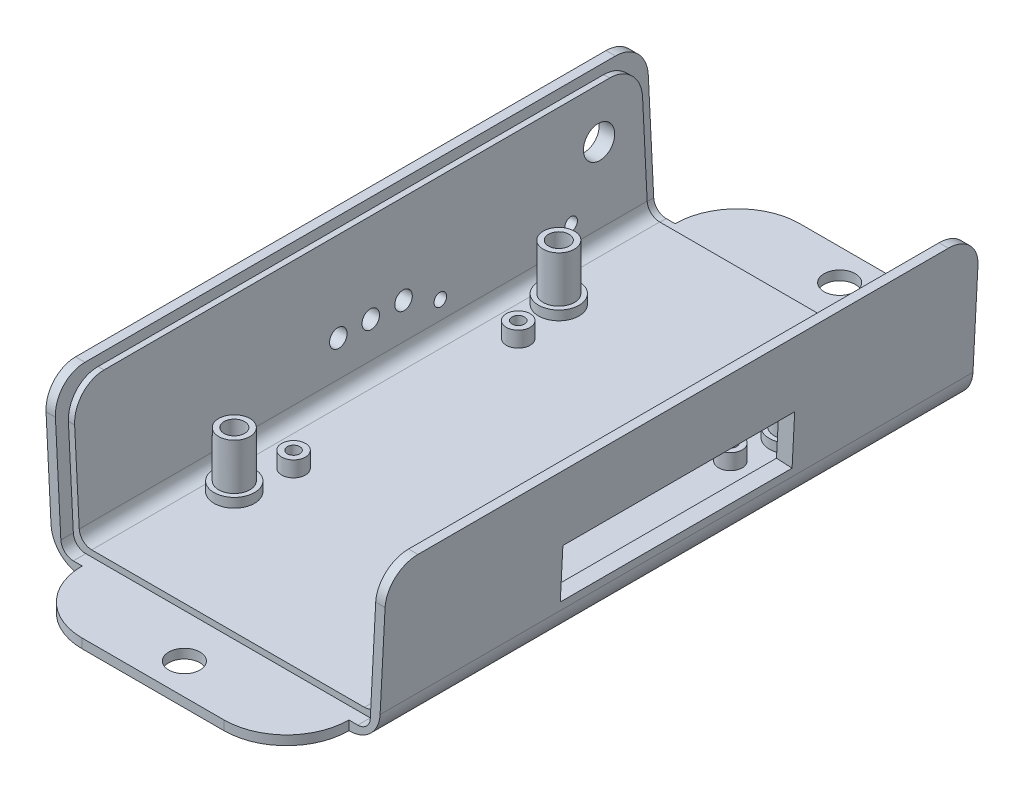
from build123d import *

# Parameters (mm, degrees)
BOSS_EXTRUDE1_DEPTH = 95
CUT_EXTRUDE1_DEPTH  = 1
CUT_EXTRUDE2_DEPTH  = 1
CUT_EXTRUDE4_DEPTH  = 2
CUT_EXTRUDE5_DEPTH  = 2
FILLET1_R           = 2
FILLET2_R           = 5
FILLET3_R           = 5
SKETCH11_R          = 3.25
SKETCH11_R_2        = 1.9
BOSS_EXTRUDE2_DEPTH = 1.5
SKETCH13_R          = 2.5
BOSS_EXTRUDE3_DEPTH = 7.4
SKETCH14_R          = 1.9
BOSS_EXTRUDE4_DEPTH = 1
SKETCH15_R          = 1.65
CUT_EXTRUDE7_DEPTH  = 15
SKETCH16_R          = 2.75
CUT_EXTRUDE8_DEPTH  = 1
SKETCH17_R          = 1
CUT_EXTRUDE9_DEPTH  = 2
SKETCH18_W          = 37.144162516
SKETCH18_H          = 8.058946384
CUT_EXTRUDE10_DEPTH = 3
SKETCH19_R          = 1
SKETCH19_R_2        = 1.4
CUT_EXTRUDE11_DEPTH = 3
SKETCH20_W          = 42.739965368
SKETCH20_H          = 1.5
BOSS_EXTRUDE5_DEPTH = 10
FILLET4_R           = 10
SKETCH21_W          = 42.739965368
SKETCH21_H          = 1.5
BOSS_EXTRUDE6_DEPTH = 10
FILLET5_R           = 10
SKETCH22_R          = 2.5
CUT_EXTRUDE12_DEPTH = 10
SKETCH23_R          = 2.5
CUT_EXTRUDE13_DEPTH = 4.5


with BuildPart() as part:
    # Sketch1 → Boss-Extrude1 (new body)
    with BuildSketch(Plane.XY):
        Polygon((-26.114805518, 0), (-27.425, 25), (-24.921569135, 25), (-23.742394101, 2.5), (23.742394101, 2.5), (24.921569135, 25), (27.425, 25), (26.114805518, 0), align=None)
    extrude(amount=BOSS_EXTRUDE1_DEPTH)

    # Sketch2 → Cut-Extrude1 (cut)
    with BuildSketch(Plane(origin=(23.546701863, -1.234030354, 0), x_dir=(0, 0, 1), z_dir=(-0.9986295347545742, 0.052335956242940705, 0))):
        Polygon((93, 3.739154736), (93, 24.853460661), (2, 24.853460661), (2, 3.739154736), (0, 3.739154736), (0, 26.853460661), (95, 26.853460661), (95, 3.739154736), align=None)
    extrude(amount=-CUT_EXTRUDE1_DEPTH, mode=Mode.SUBTRACT)

    # Sketch4 → Cut-Extrude2 (cut)
    with BuildSketch(Plane(origin=(-23.546701863, -1.234030354, 0), x_dir=(0, 0, -1), z_dir=(0.9986295347545742, 0.052335956242940414, 0))):
        Polygon((-95, 3.739154736), (-93, 3.739154736), (-93, 24.754638821), (-2, 24.754638821), (-2, 3.739154736), (0, 3.739154736), (0, 26.754638821), (-95, 26.754638821), align=None)
    extrude(amount=-CUT_EXTRUDE2_DEPTH, mode=Mode.SUBTRACT)

    # Sketch9 → Cut-Extrude4 (cut)
    with BuildSketch(Plane.XY.offset(95)):
        Polygon((-24.741023636, 2.447664044), (-24.691358668, 1.5), (24.691358668, 1.5), (24.743766447, 2.5), (23.742394101, 2.5), (-23.742394101, 2.5), (-24.743766447, 2.5), align=None)
    extrude(amount=-CUT_EXTRUDE4_DEPTH, mode=Mode.SUBTRACT)

    # Sketch10 → Cut-Extrude5 (cut)
    with BuildSketch(Plane(origin=(0, 0, 0), x_dir=(-1, 0, 0), z_dir=(0, 0, -1))):
        Polygon((-24.741023636, 2.447664044), (-24.691358668, 1.5), (24.691358668, 1.5), (24.741023636, 2.447664044), (24.743766447, 2.5), (23.742394101, 2.5), (-23.742394101, 2.5), (-24.743766447, 2.5), align=None)
    extrude(amount=-CUT_EXTRUDE5_DEPTH, mode=Mode.SUBTRACT)

    # Fillet1
    fillet1_edges = [part.edges().sort_by_distance(p)[0] for p in [
        (24.691358668, 1.5, 1),
        (-24.691358668, 1.5, 1),
        (23.742394101, 2.5, 47.5),
        (-23.742394101, 2.5, 47.5),
        (-24.691358668, 1.5, 94),
        (24.691358668, 1.5, 94),
    ]]
    fillet(fillet1_edges, radius=FILLET1_R)

    # Fillet2
    fillet2_edges = [part.edges().sort_by_distance(p)[0] for p in [
        (26.673970741, 25, 95),
        (25.34674626, 23.559201525, 93),
        (25.34674626, 23.559201525, 2),
        (-26.673970741, 25, 0),
        (-26.673970741, 25, 95),
        (-25.341574324, 23.460515117, 2),
        (-25.341574324, 23.460515117, 93),
        (26.673970741, 25, 0),
    ]]
    fillet(fillet2_edges, radius=FILLET2_R)

    # Fillet3
    fillet3_edges = [part.edges().sort_by_distance(p)[0] for p in [
        (-26.114805518, 0, 47.5),
        (26.114805518, 0, 47.5),
    ]]
    fillet(fillet3_edges, radius=FILLET3_R)

    # Sketch11 → Boss-Extrude2 (add)
    with BuildSketch(Plane(origin=(0, 2.5, 0), x_dir=(1, 0, 0), z_dir=(0, 1, 0))):
        with Locations(Location((-18.5, -21.5, 0), (0, 0, 90))):
            Circle(SKETCH11_R)
        with Locations(Location((18.5, -21.5, 0), (0, 0, 90))):
            Circle(SKETCH11_R)
        with Locations(Location((-17, -29.5, 0), (0, 0, 90))):
            Circle(SKETCH11_R_2)
        with Locations(Location((17, -29.5, 0), (0, 0, 90))):
            Circle(SKETCH11_R_2)
        with Locations(Location((18.5, -73.5, 0), (0, 0, 90))):
            Circle(SKETCH11_R)
        with Locations(Location((17, -65.5, 0), (0, 0, 90))):
            Circle(SKETCH11_R_2)
        with Locations(Location((-18.5, -73.5, 0), (0, 0, 90))):
            Circle(SKETCH11_R)
        with Locations(Location((-17, -65.5, 0), (0, 0, 90))):
            Circle(SKETCH11_R_2)
    extrude(amount=BOSS_EXTRUDE2_DEPTH)

    # Sketch13 → Boss-Extrude3 (add)
    with BuildSketch(Plane(origin=(0, 4, 0), x_dir=(1, 0, 0), z_dir=(0, 1, 0))):
        with Locations(Location((-18.5, -21.5, 0), (0, 0, 270))):
            Circle(SKETCH13_R)
        with Locations(Location((18.5, -21.5, 0), (0, 0, 270))):
            Circle(SKETCH13_R)
        with Locations(Location((-18.5, -73.5, 0), (0, 0, 90))):
            Circle(SKETCH13_R)
        with Locations(Location((18.5, -73.5, 0), (0, 0, 90))):
            Circle(SKETCH13_R)
    extrude(amount=BOSS_EXTRUDE3_DEPTH)

    # Sketch14 → Boss-Extrude4 (add)
    with BuildSketch(Plane(origin=(0, 4, 0), x_dir=(1, 0, 0), z_dir=(0, 1, 0))):
        with Locations(Location((-17, -29.5, 0), (0, 0, 90))):
            Circle(SKETCH14_R)
        with Locations(Location((17, -29.5, 0), (0, 0, 90))):
            Circle(SKETCH14_R)
        with Locations(Location((-17, -65.5, 0), (0, 0, 90))):
            Circle(SKETCH14_R)
        with Locations(Location((17, -65.5, 0), (0, 0, 90))):
            Circle(SKETCH14_R)
    extrude(amount=BOSS_EXTRUDE4_DEPTH)

    # Sketch15 → Cut-Extrude7 (cut)
    with BuildSketch(Plane(origin=(0, 11.4, 0), x_dir=(1, 0, 0), z_dir=(0, 1, 0))):
        with Locations(Location((-18.5, -21.5, 0), (0, 0, 270))):
            Circle(SKETCH15_R)
        with Locations(Location((18.5, -21.5, 0), (0, 0, 270))):
            Circle(SKETCH15_R)
        with Locations(Location((18.5, -73.5, 0), (0, 0, 270))):
            Circle(SKETCH15_R)
        with Locations(Location((-18.5, -73.5, 0), (0, 0, 270))):
            Circle(SKETCH15_R)
    extrude(amount=-CUT_EXTRUDE7_DEPTH, mode=Mode.SUBTRACT)

    # Sketch16 → Cut-Extrude8 (cut)
    with BuildSketch(Plane.XZ):
        with Locations((18.5, 21.5)):
            Circle(SKETCH16_R)
        with Locations((-18.5, 21.5)):
            Circle(SKETCH16_R)
        with Locations((18.5, 73.5)):
            Circle(SKETCH16_R)
        with Locations((-18.5, 73.5)):
            Circle(SKETCH16_R)
    extrude(amount=-CUT_EXTRUDE8_DEPTH, mode=Mode.SUBTRACT)

    # Sketch17 → Cut-Extrude9 (cut)
    with BuildSketch(Plane(origin=(0, 5, 0), x_dir=(1, 0, 0), z_dir=(0, 1, 0))):
        with Locations(Location((-17, -29.5, 0), (0, 0, 270))):
            Circle(SKETCH17_R)
        with Locations(Location((-17, -65.5, 0), (0, 0, 270))):
            Circle(SKETCH17_R)
        with Locations(Location((17, -65.5, 0), (0, 0, 270))):
            Circle(SKETCH17_R)
        with Locations(Location((17, -29.5, 0), (0, 0, 270))):
            Circle(SKETCH17_R)
    extrude(amount=-CUT_EXTRUDE9_DEPTH, mode=Mode.SUBTRACT)

    # Sketch18 → Cut-Extrude10 (cut)
    with BuildSketch(Plane(origin=(26.043275699, -1.364870245, 0), x_dir=(0, 0, -1), z_dir=(0.9986295347545742, -0.05233595624294077, 0))):
        with Locations((-47.623813875, 11.404221833)):
            Rectangle(SKETCH18_W, SKETCH18_H)
    extrude(amount=-CUT_EXTRUDE10_DEPTH, mode=Mode.SUBTRACT)

    # Sketch19 → Cut-Extrude11 (cut)
    with BuildSketch(Plane(origin=(-26.043275699, -1.364870245, 0), x_dir=(0, 0, 1), z_dir=(-0.9986295347545742, -0.05233595624294044, 0))):
        with Locations(Location((14.034522451, 8.411566152, 0), (0, 0, 270))):
            Circle(SKETCH19_R)
        with Locations(Location((34.99921548, 8.411566152, 0), (0, 0, 270))):
            Circle(SKETCH19_R)
        with Locations(Location((40.74921548, 11.111566152, 0), (0, 0, 270))):
            Circle(SKETCH19_R_2)
        with Locations(Location((45.99921548, 11.111566152, 0), (0, 0, 270))):
            Circle(SKETCH19_R_2)
        with Locations(Location((51.19921548, 11.111566152, 0), (0, 0, 270))):
            Circle(SKETCH19_R_2)
    extrude(amount=-CUT_EXTRUDE11_DEPTH, mode=Mode.SUBTRACT)

    # Sketch20 → Boss-Extrude5 (add)
    with BuildSketch(Plane(origin=(0, 0, 0), x_dir=(-1, 0, 0), z_dir=(0, 0, -1))):
        with Locations((0, 0.75)):
            Rectangle(SKETCH20_W, SKETCH20_H)
    extrude(amount=BOSS_EXTRUDE5_DEPTH)

    # Fillet4
    fillet4_edges = [part.edges().sort_by_distance(p)[0] for p in [
        (21.369982684, 0.75, -10),
        (-21.369982684, 0.75, -10),
    ]]
    fillet(fillet4_edges, radius=FILLET4_R - 0.0001)  # a hair under: the kernel refuses the full size

    # Sketch21 → Boss-Extrude6 (add)
    with BuildSketch(Plane.XY.offset(95)):
        with Locations((0, 0.75)):
            Rectangle(SKETCH21_W, SKETCH21_H)
    extrude(amount=BOSS_EXTRUDE6_DEPTH)

    # Fillet5
    fillet5_edges = [part.edges().sort_by_distance(p)[0] for p in [
        (-21.369982684, 0.75, 105),
        (21.369982684, 0.75, 105),
    ]]
    fillet(fillet5_edges, radius=FILLET5_R - 0.0001)  # a hair under: the kernel refuses the full size

    # Sketch22 → Cut-Extrude12 (cut)
    with BuildSketch(Plane(origin=(0, 1.5, 0), x_dir=(1, 0, 0), z_dir=(0, 1, 0))):
        with Locations(Location((0, 5, 0), (0, 0, 180))):
            Circle(SKETCH22_R)
        with Locations(Location((0, -100, 0), (0, 0, 180))):
            Circle(SKETCH22_R)
    extrude(amount=-CUT_EXTRUDE12_DEPTH, mode=Mode.SUBTRACT)

    # Sketch23 → Cut-Extrude13 (cut)
    with BuildSketch(Plane(origin=(-26.043275699, -1.364870245, 0), x_dir=(0, 0, 1), z_dir=(-0.9986295347545742, -0.052335956242940324, 0))):
        with Locations(Location((9.104177009, 17.111566152, 0), (0, 0, 270))):
            Circle(SKETCH23_R)
    extrude(amount=-CUT_EXTRUDE13_DEPTH, mode=Mode.SUBTRACT)


solid = part.part
